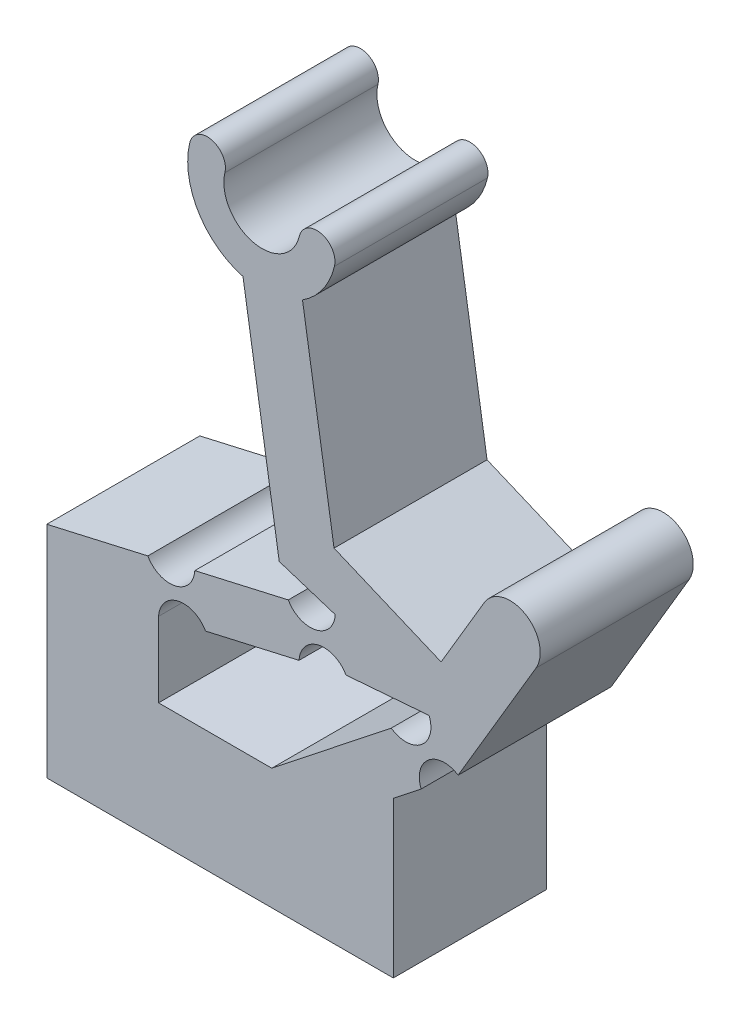
from build123d import *

# Parameters (mm, degrees)
BOSS_EXTRUDE1_DEPTH = 6.35


with BuildPart() as part:
    # Sketch-ConfigUp → Boss-Extrude1 (new body)
    with BuildSketch(Plane.XY):
        with BuildLine():
            Line((10.021727413, -2.126072581), (6.141891272, -3.013355806))
            ThreePointArc((6.141891272, -3.013355806), (5.334259684, -3.967416191), (4.19222487, -3.459226774))
            Line((4.19222487, -3.459226774), (0, -4.417950459))
            Line((0, -4.417950459), (0, -13.535586773))
            Line((0, -13.535586773), (14.379797861, -13.535586773))
            Line((14.379797861, -13.535586773), (14.379797861, -7.079846939))
            Line((14.379797861, -7.079846939), (15.535519303, -6.166037965))
            ThreePointArc((15.535519303, -6.166037965), (15.838159222, -4.970905848), (17.069062626, -4.901562429))
            Line((17.069062626, -4.901562429), (20.303406499, 0.567157385))
            ThreePointArc((20.303406499, 0.567157385), (19.863815991, 2.27939574), (18.151577636, 1.839805232))
            Line((18.151577636, 1.839805232), (16.363210082, -1.184017051))
            Line((16.363210082, -1.184017051), (11.92108479, 0.683388111))
            Line((11.92108479, 0.683388111), (10.612044284, 8.949446168))
            ThreePointArc((10.612044284, 8.949446168), (11.455361473, 9.757748862), (11.93802712, 10.821502121))
            ThreePointArc((11.93802712, 10.821502121), (11.383852324, 11.725874995), (10.47947945, 11.1717002))
            ThreePointArc((10.47947945, 11.1717002), (8.565223533, 9.998696882), (7.392220215, 11.912952799))
            ThreePointArc((7.392220215, 11.912952799), (6.838045419, 12.817325673), (5.933672545, 12.263150877))
            ThreePointArc((5.933672545, 12.263150877), (6.284023536, 9.961037929), (8.14281538, 8.558410849))
            Line((8.14281538, 8.558410849), (9.645907573, -0.933004638))
            Line((9.645907573, -0.933004638), (11.971393815, -1.680201614))
            ThreePointArc((11.971393815, -1.680201614), (11.163762227, -2.634261998), (10.021727413, -2.126072581))
        make_face()
        with BuildLine():
            Line((10.46759838, -4.075738983), (6.58776224, -4.963022209))
            ThreePointArc((6.58776224, -4.963022209), (5.445727426, -4.454832792), (4.638095837, -5.408893176))
            Line((4.638095837, -5.408893176), (4.638095837, -8.517320963))
            Line((4.638095837, -8.517320963), (7.202243293, -8.517320963))
            Line((7.202243293, -8.517320963), (9.337162908, -8.517320963))
            Line((9.337162908, -8.517320963), (14.281417248, -4.607984488))
            Line((14.281417248, -4.607984488), (14.295062569, -4.597195368))
            ThreePointArc((14.295062569, -4.597195368), (15.544655143, -4.565282976), (15.863905166, -3.356738635))
            Line((15.863905166, -3.356738635), (12.417264783, -3.629868016))
            ThreePointArc((12.417264783, -3.629868016), (11.275229969, -3.121678599), (10.46759838, -4.075738983))
        make_face(mode=Mode.SUBTRACT)
    extrude(amount=BOSS_EXTRUDE1_DEPTH)


solid = part.part
